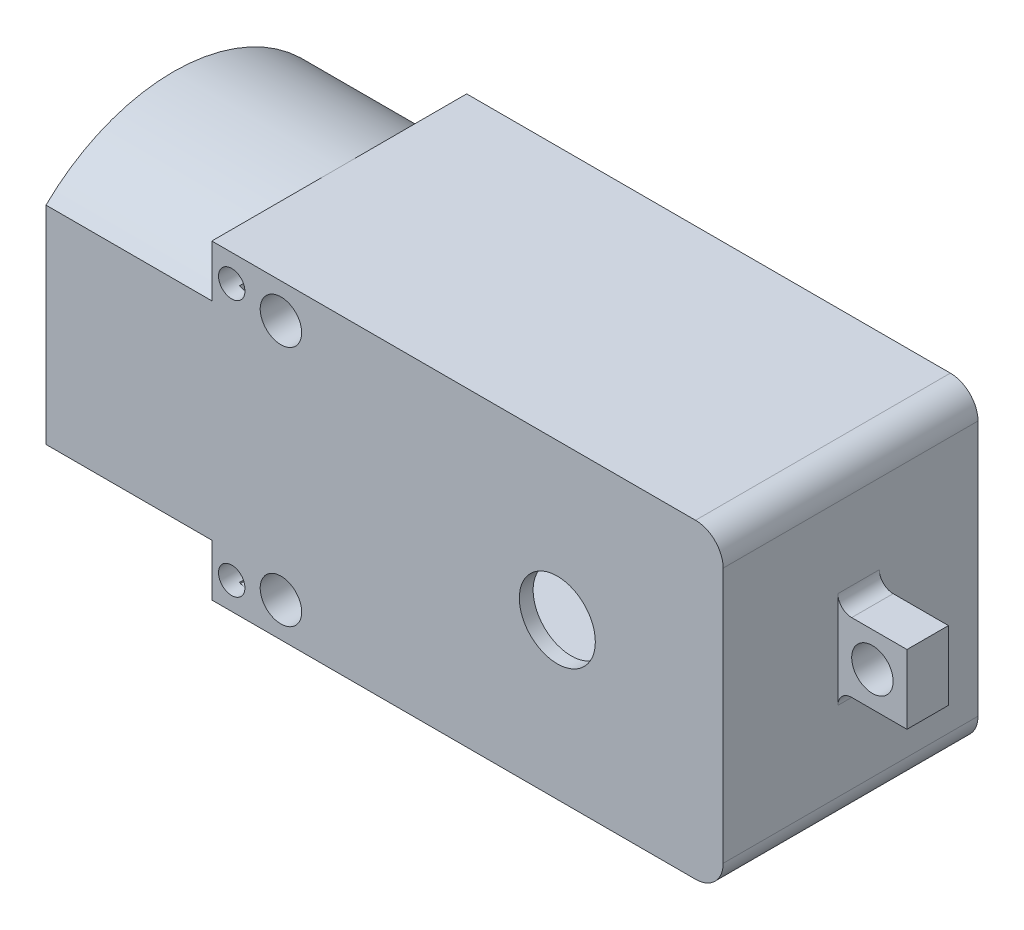
from build123d import *

# Parameters (mm, degrees)
SKETCH1_R                = 1.5
BOSS_EXTRUDE1_DEPTH      = 9.22
BOSS_EXTRUDE2_DEPTH      = 12
SHELL1_START             = -10
SHELL1_OUTLINE_W         = 20.5
SHELL1_OUTLINE_H         = 16.44
SHELL1_DEPTH             = 27.5
SHELL1_START_2           = -29.5
SHELL1_2_DEPTH           = 14.5
SHELL1_START_3           = -16.5
SHELL1_3_DEPTH           = 1.5
SHELL1_START_4           = -8.22
SHELL1_4_DEPTH           = 16.44
SKETCH3_R                = 1.5
BOSS_EXTRUDE3_DEPTH      = 1
BOSS_EXTRUDE4_DEPTH      = 1.5
BOSS_EXTRUDE4_DEPTH_BACK = 1.5
SKETCH6_W                = 5
SKETCH6_H                = 5
SKETCH6_R                = 1.5
SKETCH7_R                = 2.75
CUT_EXTRUDE1_DEPTH       = 3
FILLET1_R                = 1
CUT_EXTRUDE2_DEPTH       = 20
CUT_EXTRUDE2_DEPTH_BACK  = 20
SKETCH8_R                = 0.956029162


with BuildPart() as part:
    # Sketch1 → Boss-Extrude1 (new, symmetric)
    with BuildSketch(Plane.XY):
        with BuildLine():
            Line((17.5, -11.25), (-17.5, -11.25))
            Line((-17.5, -11.25), (-17.5, 11.25))
            Line((-17.5, 11.25), (17.5, 11.25))
            ThreePointArc((17.5, 11.25), (18.914213562, 10.664213562), (19.5, 9.25))
            Line((19.5, 9.25), (19.5, -9.25))
            ThreePointArc((19.5, -9.25), (18.914213562, -10.664213562), (17.5, -11.25))
        make_face()
        with Locations((-12.5, 8.75)):
            Circle(SKETCH1_R, mode=Mode.SUBTRACT)
        with Locations((-12.5, -8.75)):
            Circle(SKETCH1_R, mode=Mode.SUBTRACT)
    extrude(amount=BOSS_EXTRUDE1_DEPTH, both=True)

    # Sketch2 → Boss-Extrude2 (add)
    with BuildSketch(Plane.ZY.offset(17.5)):
        with BuildLine():
            Line((9.22, -7.5), (9.22, 7.5))
            ThreePointArc((9.22, 7.5), (0, 11.25), (-9.22, 7.5))
            Line((-9.22, 7.5), (-9.22, -7.5))
            ThreePointArc((-9.22, -7.5), (0, -11.25), (9.22, -7.5))
        make_face()
    extrude(amount=BOSS_EXTRUDE2_DEPTH)

    # Shell1: read off the stored shape, not the designer's step
    # Shell1 outline → Shell1 (cut)
    with BuildSketch(Plane.YZ.offset(SHELL1_START)):
        Rectangle(SHELL1_OUTLINE_W, SHELL1_OUTLINE_H)
    extrude(amount=SHELL1_DEPTH, mode=Mode.SUBTRACT)

    # Shell1 2 outline → Shell1 2 (cut)
    with BuildSketch(Plane.YZ.offset(SHELL1_START_2)):
        with BuildLine():
            ThreePointArc((7.068411902, -8.22), (10.25, 0), (7.068411902, 8.22))
            Line((7.068411902, 8.22), (-7.068411902, 8.22))
            ThreePointArc((-7.068411902, 8.22), (-10.25, 0), (-7.068411902, -8.22))
            Line((-7.068411902, -8.22), (7.068411902, -8.22))
        make_face()
    extrude(amount=SHELL1_2_DEPTH, mode=Mode.SUBTRACT)

    # Shell1 3 outline → Shell1 3 (cut)
    with BuildSketch(Plane.YZ.offset(SHELL1_START_3)):
        with BuildLine():
            Line((10.25, 0), (10.25, 8.22))
            Line((10.25, 8.22), (7.068411902, 8.22))
            ThreePointArc((7.068411902, 8.22), (9.426855331, 4.407122157), (10.25, 0))
        make_face()
        with BuildLine():
            Line((10.25, -8.22), (10.25, 0))
            ThreePointArc((10.25, 0), (9.426855331, -4.407122157), (7.068411902, -8.22))
            Line((7.068411902, -8.22), (10.25, -8.22))
        make_face()
        with BuildLine():
            ThreePointArc((-10.25, 0), (-9.426855331, 4.407122157), (-7.068411902, 8.22))
            Line((-7.068411902, 8.22), (-10.25, 8.22))
            Line((-10.25, 8.22), (-10.25, 0))
        make_face()
        with BuildLine():
            Line((-10.25, -8.22), (-7.068411902, -8.22))
            ThreePointArc((-7.068411902, -8.22), (-9.426855331, -4.407122157), (-10.25, 0))
            Line((-10.25, 0), (-10.25, -8.22))
        make_face()
    extrude(amount=SHELL1_3_DEPTH, mode=Mode.SUBTRACT)

    # Shell1 4 outline → Shell1 4 (cut)
    with BuildSketch(Plane.XY.offset(SHELL1_START_4)):
        with BuildLine():
            ThreePointArc((-14.5, -10.25), (-14.871708245, -9.540569415), (-15, -8.75))
            Line((-15, -8.75), (-15, -10.25))
            Line((-15, -10.25), (-14.5, -10.25))
        make_face()
        with BuildLine():
            ThreePointArc((-10, 8.75), (-12.499999993, 6.25), (-15, 8.749999987))
            Line((-15, 8.749999987), (-15, -8.75))
            ThreePointArc((-15, -8.75), (-12.5, -6.25), (-10, -8.75))
            Line((-10, -8.75), (-10, 8.75))
        make_face()
        with BuildLine():
            Line((-14.5, 10.25), (-15, 10.25))
            Line((-15, 10.25), (-15, 8.749999987))
            ThreePointArc((-15, 8.749999987), (-14.871708247, 9.540569409), (-14.5, 10.25))
        make_face()
        with BuildLine():
            ThreePointArc((-10.5, 10.25), (-10.128291755, 9.540569415), (-10, 8.75))
            Line((-10, 8.75), (-10, 10.25))
            Line((-10, 10.25), (-10.5, 10.25))
        make_face()
        with BuildLine():
            Line((-10, -10.25), (-10, -8.75))
            ThreePointArc((-10, -8.75), (-10.128291755, -9.540569415), (-10.5, -10.25))
            Line((-10.5, -10.25), (-10, -10.25))
        make_face()
        with BuildLine():
            ThreePointArc((18.5, 9.25), (18.207106781, 9.957106781), (17.5, 10.25))
            Line((17.5, 10.25), (17.5, -10.25))
            ThreePointArc((17.5, -10.25), (18.207106781, -9.957106781), (18.5, -9.25))
            Line((18.5, -9.25), (18.5, 9.25))
        make_face()
    extrude(amount=SHELL1_4_DEPTH, mode=Mode.SUBTRACT)

    # Sketch3 → Boss-Extrude3 (add)
    with BuildSketch(Plane.ZY.offset(17.5)):
        with BuildLine():
            Line((-9.22, 7.5), (-9.22, -7.5))
            ThreePointArc((-9.22, -7.5), (0, -11.25), (9.22, -7.5))
            Line((9.22, -7.5), (9.22, 7.5))
            ThreePointArc((9.22, 7.5), (0, 11.25), (-9.22, 7.5))
        make_face()
        Circle(SKETCH3_R, mode=Mode.SUBTRACT)
    extrude(amount=BOSS_EXTRUDE3_DEPTH)

    # Sketch6 → Boss-Extrude4 (add, two sides: drawn at the far end of the back side and taken through both)
    with BuildSketch(Plane.XY.offset(-0.58).offset(-BOSS_EXTRUDE4_DEPTH_BACK)):
        with Locations((22, 0)):
            Rectangle(SKETCH6_W, SKETCH6_H)
        with Locations((22, 0)):
            Circle(SKETCH6_R, mode=Mode.SUBTRACT)
    extrude(amount=BOSS_EXTRUDE4_DEPTH + BOSS_EXTRUDE4_DEPTH_BACK)

    # Sketch7 → Cut-Extrude1 (cut)
    with BuildSketch(Plane.XY.offset(9.22)):
        with Locations((7.5, 0)):
            Circle(SKETCH7_R)
    extrude(amount=-CUT_EXTRUDE1_DEPTH, mode=Mode.SUBTRACT)

    # Fillet1
    fillet1_edges = [part.edges().sort_by_distance(p)[0] for p in [
        (19.5, 2.5, -0.58),
        (19.5, -2.5, -0.58),
    ]]
    fillet(fillet1_edges, radius=FILLET1_R)

    # Sketch8 → Cut-Extrude2 (cut, two sides: drawn at the far end of the back side and taken through both)
    with BuildSketch(Plane.XY.offset(-0.58).offset(-CUT_EXTRUDE2_DEPTH_BACK)):
        with Locations(Location((-16.061963922, 9.293970838, 0), (0, 0, 242.73008166))):
            Circle(SKETCH8_R)
        with Locations(Location((-16.061963922, -9.293970838, 0), (0, 0, 242.730056197))):
            Circle(SKETCH8_R)
    extrude(amount=CUT_EXTRUDE2_DEPTH + CUT_EXTRUDE2_DEPTH_BACK, mode=Mode.SUBTRACT)


solid = part.part
